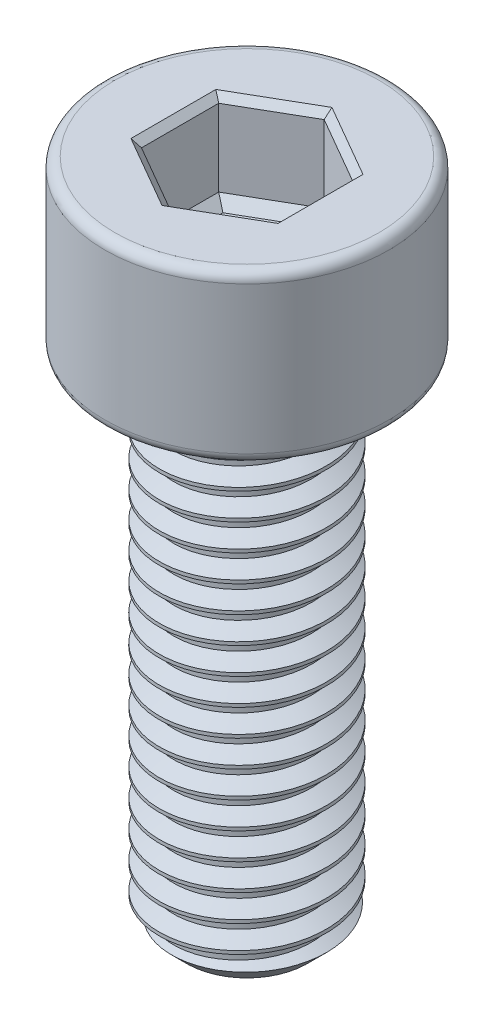
from build123d import *

# Parameters (mm, degrees)
SKETCH1_R           = 2.5
BOSS_EXTRUDE1_DEPTH = 15
THREAD1_PITCH       = 0.8
SKETCH5_R           = 4.25
BOSS_EXTRUDE2_DEPTH = 5
FILLET1_R           = 0.3
CUT_EXTRUDE1_DEPTH  = 2.5
CHAMFER1_SIZE       = 0.2
CUT_EXTRUDE2_DEPTH  = 0.3
CUT_EXTRUDE2_DRAFT  = -45


with BuildPart() as part:
    # Sketch1 → Boss-Extrude1 (new body)
    with BuildSketch(Plane(origin=(0, 0, 0), x_dir=(1, 0, 0), z_dir=(0, 1, 0))):
        with Locations(Location((0, 0, 0), (0, 0, 270))):
            Circle(SKETCH1_R)
    extrude(amount=BOSS_EXTRUDE1_DEPTH)

    # Thread1: the profile of Thread Profile1 profile screwed along a right-hand helix of 20 turns, 8 arcs to a turn; built about Z, then put on its axis
    thread1_z = Axis((0, 0, 0), (0, 0, 1))
    thread1_corners = [(2.5003, 0, -0.000173205), (2.5003, 0, 0.700173203), (2.0669873, 0, 0.449999999), (2.0669873, 0, 0.249999999)]
    with BuildLine(mode=Mode.PRIVATE) as thread1_profile:
        Line(thread1_corners[0], thread1_corners[1])
        Line(thread1_corners[1], thread1_corners[2])
        Line(thread1_corners[2], thread1_corners[3])
        Line(thread1_corners[3], thread1_corners[0])
    thread1_cap = Face(thread1_profile.wire())
    thread1_turn_angles = [0, 22.5, 45, 67.5, 90, 112.5, 135, 157.5, 180, 202.5, 225, 247.5, 270, 292.5, 315, 337.5, 360]
    thread1_turn_weights = [1, 0.9238795325112867, 1, 0.9238795325112867, 1, 0.9238795325112867, 1, 0.9238795325112867, 1, 0.9238795325112867, 1, 0.9238795325112867, 1, 0.9238795325112867, 1, 0.9238795325112867, 1]
    thread1_turn_rails = [Edge.make_bspline([Vector(p[0], p[1], 0).rotate(thread1_z, thread1_turn_angles[k]) / thread1_turn_weights[k] + Vector(0, 0, p[2] + THREAD1_PITCH * thread1_turn_angles[k] / 360) for k in range(17)], [0, 0, 0, 1, 1, 2, 2, 3, 3, 4, 4, 5, 5, 6, 6, 7, 7, 8, 8, 8], 2, thread1_turn_weights) for p in thread1_corners]
    thread1_turn_sides = [Face.make_surface_from_curves(thread1_turn_rails[p[0]], thread1_turn_rails[p[1]]) for p in [(0, 1), (1, 2), (2, 3), (3, 0)]]
    thread1 = Plane(origin=(0, 16, 0), x_dir=(-1, 0, 0), z_dir=(0, -1, 0)) * Solid(Shell([*[p.moved(Location((0, 0, THREAD1_PITCH * i))) for i in range(20) for p in thread1_turn_sides], thread1_cap, thread1_cap.rotate(thread1_z, 7200).moved(Location((0, 0, THREAD1_PITCH * 7200 / 360)))]))
    add(thread1, mode=Mode.SUBTRACT)

    # Sketch5 → Boss-Extrude2 (add)
    with BuildSketch(Plane(origin=(0, 15, 0), x_dir=(1, 0, 0), z_dir=(0, 1, 0))):
        with Locations(Location((0, 0, 0), (0, 0, 270))):
            Circle(SKETCH5_R)
    extrude(amount=BOSS_EXTRUDE2_DEPTH)

    # Fillet1
    fillet1_edges = [part.edges().sort_by_distance(p)[0] for p in [
        (0, 15, -4.25),
        (0, 20, -4.25),
    ]]
    fillet(fillet1_edges, radius=FILLET1_R)

    # Sketch6 → Cut-Revolve1 (revolve, cut)
    with BuildSketch(Plane.XY, mode=Mode.PRIVATE) as cut_revolve1_sk:
        Polygon((2.51, 0), (2.51, 0.7), (1.81, 0), align=None)
    revolve(cut_revolve1_sk.sketch.rotate(Axis((0, 0, 0), (0, 1, 0)), 138.279472978), axis=Axis((0, 0, 0), (0, 1, 0)), mode=Mode.SUBTRACT)

    # Sketch7 → Cut-Extrude1 (cut)
    with BuildSketch(Plane(origin=(0, 20, 0), x_dir=(1, 0, 0), z_dir=(0, 1, 0))):
        Polygon((0, 2.309401077), (-2, 1.154700538), (-2, -1.154700538), (0, -2.309401077), (2, -1.154700538), (2, 1.154700538), align=None)
    extrude(amount=-CUT_EXTRUDE1_DEPTH, mode=Mode.SUBTRACT)

    # Chamfer1
    chamfer1_edges = [part.edges().sort_by_distance(p)[0] for p in [
        (1, 20, -1.732050808),
        (-1, 20, -1.732050808),
        (-2, 20, 0),
        (-1, 20, 1.732050808),
        (1, 20, 1.732050808),
        (2, 20, 0),
    ]]
    chamfer(chamfer1_edges, length=CHAMFER1_SIZE)


with BuildPart() as cut_extrude2_tool:
    # Sketch8 → Cut-Extrude2 (with draft: the straight prism first)
    with BuildSketch(Plane(origin=(0, 17.5, 0), x_dir=(1, 0, 0), z_dir=(0, 1, 0))):
        Polygon((0, 2.309401077), (-2, 1.154700538), (-2, -1.154700538), (0, -2.309401077), (2, -1.154700538), (2, 1.154700538), align=None)
    extrude(amount=-CUT_EXTRUDE2_DEPTH)
    # Cut-Extrude2: the draft: its side faces are tilted about the plane it starts from
    cut_extrude2_sides = [cut_extrude2_tool.faces().sort_by_distance(p)[0] for p in [
        (-1, 17.35, -1.732050808),
        (-2, 17.35, 0),
        (-1, 17.35, 1.732050808),
        (1, 17.35, 1.732050808),
        (2, 17.35, 0),
        (1, 17.35, -1.732050808),
    ]]
    draft(cut_extrude2_sides, Plane(origin=(0, 17.5, 0), x_dir=(1, 0, 0), z_dir=(0, 1, 0)), CUT_EXTRUDE2_DRAFT)


with BuildPart() as part_1:
    add(part.part)

    # Cut-Extrude2: cut by cut_extrude2_tool
    add(cut_extrude2_tool.part, mode=Mode.SUBTRACT)


solid = part_1.part
